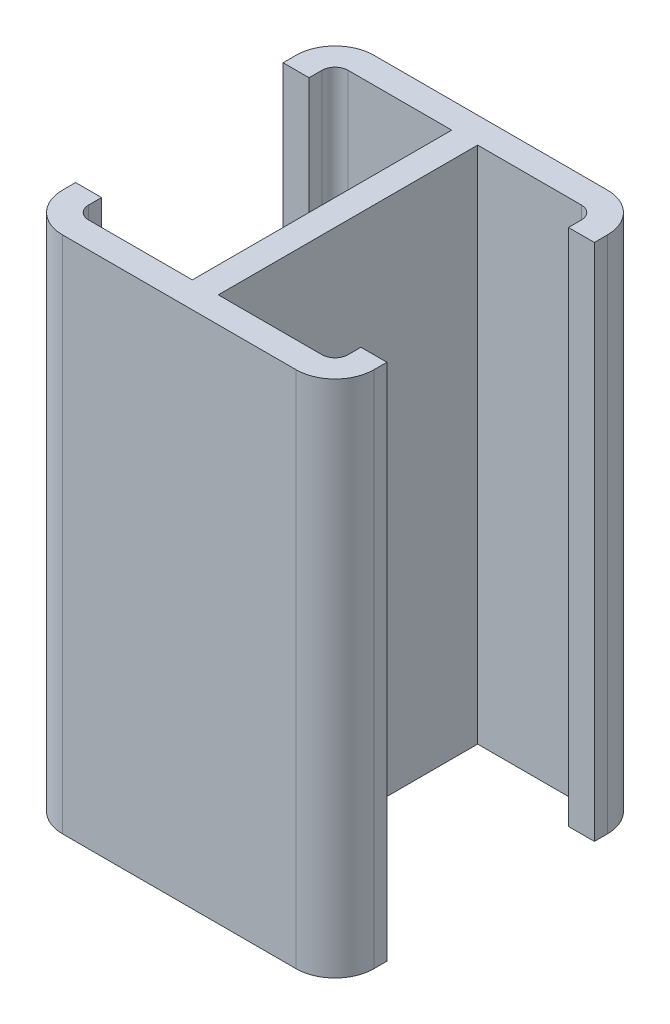
from build123d import *

# Parameters (mm, degrees)
EXTRUDE_1_DEPTH = 200


with BuildPart() as part:
    # ｽｹｯﾁ1 → ﾎﾞｽ - 押し出し1 (new body)
    with BuildSketch(Plane(origin=(0, 0, 0), x_dir=(1, 0, 0), z_dir=(0, 1, 0))):
        with BuildLine():
            Line((0, 0), (0, -60))
            Line((0, -60), (45, -60))
            ThreePointArc((45, -60), (55.606601718, -55.606601718), (60, -45))
            Line((60, -45), (60, -40))
            Line((60, -40), (50, -40))
            Line((50, -40), (50, -45))
            ThreePointArc((50, -45), (48.535533906, -48.535533906), (45, -50))
            Line((45, -50), (5, -50))
            Line((5, -50), (5, 0))
            Line((5, 0), (0, 0))
        make_face()
    extrude(amount=EXTRUDE_1_DEPTH)

    # ﾐﾗｰ1: part across plane


with BuildPart() as part_1:
    add(part.part)
    add(part.part.mirror(Plane(origin=(0, 200, 0), x_dir=(0, 0, 1), z_dir=(1, 0, 0))))

    # ﾐﾗｰ2: part across plane


with BuildPart() as part_2:
    add(part_1.part)
    add(part_1.part.mirror(Plane(origin=(5, 200, 0), x_dir=(1, 0, 0), z_dir=(0, 0, 1))))


solid = part_2.part
